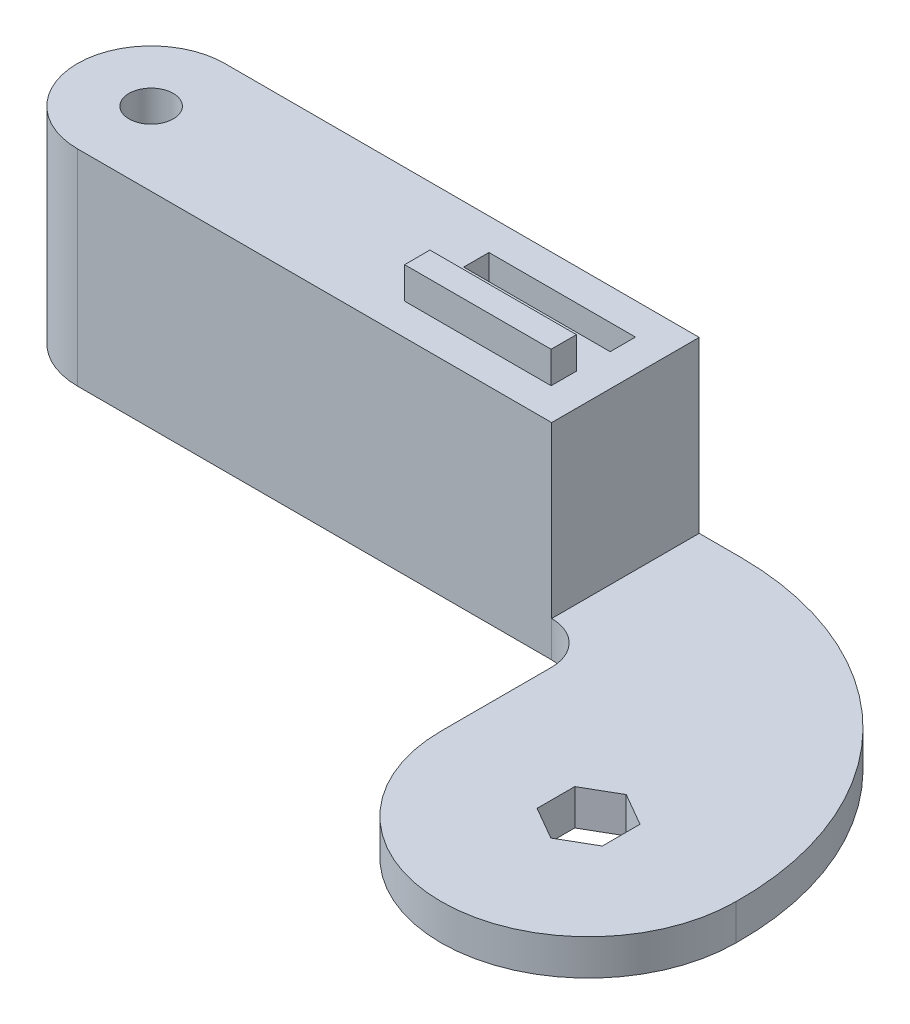
from build123d import *

# Parameters (mm, degrees)
EXTRUDE_1_DEPTH     = 6.8
CUT_EXTRUDE_1_DEPTH = 6.9
SKETCH_3_W          = 104
SKETCH_3_H          = 28
EXTRUDE_2_DEPTH     = 32.2
SKETCH_4_W          = 27.8
SKETCH_4_H          = 4.8
CUT_EXTRUDE_2_DEPTH = 6
SKETCH_4_3_W        = 27.8
SKETCH_4_3_H        = 4.8
EXTRUDE_3_DEPTH     = 6
SKETCH_5_W          = 14
SKETCH_5_H          = 14
CUT_EXTRUDE_3_DEPTH = 14
SKETCH_6_R          = 4.2
CUT_EXTRUDE_4_DEPTH = 155.304892988
FILLET_1_R          = 14


with BuildPart() as part:
    # Эскиз1 → Бобышка-Вытянуть1 (new body)
    with BuildSketch(Plane(origin=(0, 0, 0), x_dir=(1, 0, 0), z_dir=(0, 1, 0))):
        with BuildLine():
            ThreePointArc((-28, 0), (0, -28), (28, 0))
            ThreePointArc((28, 0), (11.895099372, 40.186413418), (-28, 57))
            Line((-28, 57), (-140, 57))
            Line((-140, 57), (-140, 29))
            Line((-140, 29), (-36, 29))
            ThreePointArc((-36, 29), (-30.343145751, 26.656854249), (-28, 21))
            Line((-28, 21), (-28, 0))
        make_face()
    extrude(amount=EXTRUDE_1_DEPTH)

    # Эскиз2 → Вырез-Вытянуть1 (cut)
    with BuildSketch(Plane(origin=(0, 6.8, 0), x_dir=(1, 0, 0), z_dir=(0, 1, 0))):
        Polygon((0, 7.15), (-6.192081637, 3.575), (-6.192081637, -3.575), (0, -7.15), (6.192081637, -3.575), (6.192081637, 3.575), align=None)
    extrude(amount=-CUT_EXTRUDE_1_DEPTH, mode=Mode.SUBTRACT)

    # Эскиз3 → Бобышка-Вытянуть2 (add)
    with BuildSketch(Plane(origin=(0, 6.8, 0), x_dir=(1, 0, 0), z_dir=(0, 1, 0))):
        with Locations((-88, 43)):
            Rectangle(SKETCH_3_W, SKETCH_3_H)
    extrude(amount=EXTRUDE_2_DEPTH)

    # Эскиз4 → Вырез-Вытянуть2 (cut)
    with BuildSketch(Plane(origin=(0, 39, 0), x_dir=(1, 0, 0), z_dir=(0, 1, 0))):
        with Locations((-56, 48.6)):
            Rectangle(SKETCH_4_W, SKETCH_4_H)
    extrude(amount=-CUT_EXTRUDE_2_DEPTH, mode=Mode.SUBTRACT)

    # Эскиз4<3> → Бобышка-Вытянуть3 (add)
    with BuildSketch(Plane(origin=(0, 39, 0), x_dir=(1, 0, 0), z_dir=(0, 1, 0))):
        with Locations((-56, 37.4)):
            Rectangle(SKETCH_4_3_W, SKETCH_4_3_H)
    extrude(amount=EXTRUDE_3_DEPTH)

    # Эскиз5 → Вырез-Вытянуть3 (cut)
    with BuildSketch(Plane.XZ):
        with Locations((-126, -43)):
            Rectangle(SKETCH_5_W, SKETCH_5_H)
    extrude(amount=-CUT_EXTRUDE_3_DEPTH, mode=Mode.SUBTRACT)

    # Эскиз6 → Вырез-Вытянуть4 (cut, through all)
    with BuildSketch(Plane.XZ.offset(-14)):
        with Locations(Location((-126, -43, 0), (0, 0, 270))):
            Circle(SKETCH_6_R)
    extrude(amount=-CUT_EXTRUDE_4_DEPTH, mode=Mode.SUBTRACT)

    # Скругление1
    fillet_1_edges = [part.edges().sort_by_distance(p)[0] for p in [
        (-140, 19.5, -29),
        (-140, 19.5, -57),
    ]]
    fillet(fillet_1_edges, radius=FILLET_1_R - 0.0001)  # a hair under: the kernel refuses the full size


solid = part.part
